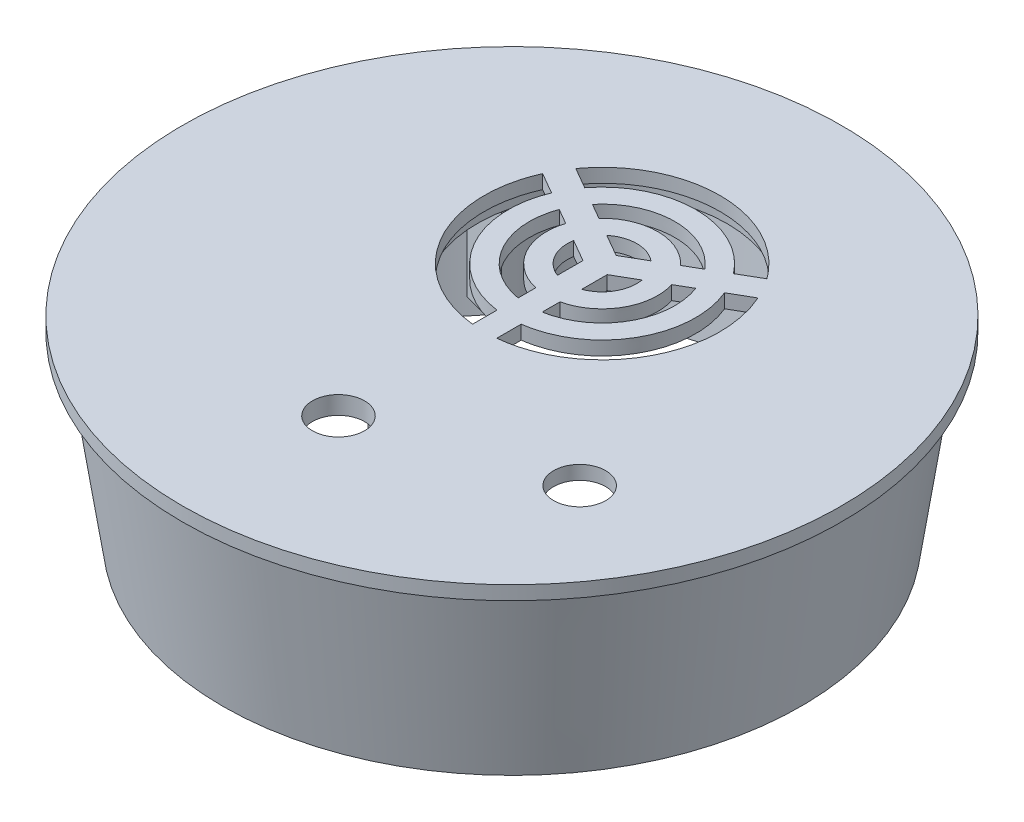
from build123d import *

# Parameters (mm, degrees)
INSIDECAPPLANE_SKETCH_R                        = 27.5
INSIDECAPPLANE_SKETCH_R_2                      = 18
SPEAKER_EXTRUDE_BOSS_DEPTH                     = 2
BOSS_EXTRUDE_SCREW_BOSSES_START                = 2.1
BOSS_EXTRUDE_SCREW_BOSSES_DEPTH                = 17
INSIDECAPPLANE2_SKETCH_R                       = 7.5
POT_SWITCH_MOUNT_THICKNESS_ADJ_DEPTH           = 0.6
HOLES_START                                    = -2
SKETCH5_R                                      = 3.75
HOLES_FOR_VOLUME_POT_AND_TESTING_PASSTHR_DEPTH = 74.995881596
VENT1_START                                    = -2
VENT1_DEPTH                                    = 2
F_4_0MM_DOWEL_HOLE1_D                          = 3.8
F_4_0MM_DOWEL_HOLE1_DEPTH                      = 18


# Read off the part's stored shape, not the designer's step: Vent1
with BuildPart() as part:
    # Sketch1 → Revolve1 (revolve)
    with BuildSketch(Plane.XY, mode=Mode.PRIVATE) as revolve1_sk:
        with BuildLine():
            Line((0, 0), (-47.5, 0))
            Line((-47.5, 0), (-47.5, -2))
            Line((-47.5, -2), (-45.5, -2))
            Line((-45.5, -2), (-41.702855897, -27.901871877))
            Line((-41.702855897, -27.901871877), (-39.681479372, -27.901871877))
            Line((-39.681479372, -27.901871877), (-43.310762695, -3.145046985))
            ThreePointArc((-43.310762695, -3.145046985), (-43.077990749, -2.346183124), (-42.321337927, -2))
            Line((-42.321337927, -2), (0, -2))
            Line((0, -2), (0, 0))
        make_face()
    revolve(revolve1_sk.sketch.rotate(Axis((0, 0, 0), (0, -1, 0)), 270), axis=Axis((0, 0, 0), (0, -1, 0)))

    # InsideCapPlane Sketch → Speaker Extrude Boss (add)
    with BuildSketch(Plane(origin=(0, -2, 0), x_dir=(-1, 0, 0), z_dir=(0, -1, 0))):
        with Locations(Location((0, 13, 0), (0, 0, 90))):
            Circle(INSIDECAPPLANE_SKETCH_R)
        with Locations(Location((0, 13, 0), (0, 0, 90))):
            Circle(INSIDECAPPLANE_SKETCH_R_2, mode=Mode.SUBTRACT)
    extrude(amount=SPEAKER_EXTRUDE_BOSS_DEPTH)

    # InsideCapPlane3 Sketch → Boss-Extrude-Screw-Bosses (add)
    with BuildSketch(Plane(origin=(0, -1.9, 0), x_dir=(-1, 0, 0), z_dir=(0, -1, 0)).offset(BOSS_EXTRUDE_SCREW_BOSSES_START)):
        with BuildLine():
            Line((-14.495998085, 27.495379937), (-19.445851089, 32.445021867))
            ThreePointArc((-19.445851089, 32.445021867), (-23.81584519, 26.749746103), (-26.562960223, 20.11752374))
            Line((-26.562960223, 20.11752374), (-19.801479439, 18.305790425))
            ThreePointArc((-19.801479439, 18.305790425), (-17.753630051, 23.249810731), (-14.495998085, 27.495379937))
        make_face()
        with BuildLine():
            Line((-5.305790425, -6.801479439), (-7.11752374, -13.562960223))
            ThreePointArc((-7.11752374, -13.562960223), (0.039898848, -14.499971056), (7.194572349, -13.542195251))
            Line((7.194572349, -13.542195251), (5.36322666, -6.786000096))
            ThreePointArc((5.36322666, -6.786000096), (0.029742777, -7.499978424), (-5.305790425, -6.801479439))
        make_face()
        with BuildLine():
            Line((26.562882451, 20.117813982), (19.801421464, 18.306006787))
            ThreePointArc((19.801421464, 18.306006787), (17.753342156, 23.250309376), (14.495342186, 27.496035834))
            Line((14.495342186, 27.496035834), (19.444971226, 32.445901728))
            ThreePointArc((19.444971226, 32.445901728), (23.815458989, 26.750415017), (26.562882451, 20.117813982))
        make_face()
    extrude(amount=BOSS_EXTRUDE_SCREW_BOSSES_DEPTH)

    # InsideCapPlane2 Sketch → Pot Switch Mount Thickness Adj (add)
    with BuildSketch(Plane(origin=(0, -2, 0), x_dir=(-1, 0, 0), z_dir=(0, -1, 0))):
        with Locations(Location((0, -25, 0), (0, 0, 90))):
            Circle(INSIDECAPPLANE2_SKETCH_R)
    extrude(amount=POT_SWITCH_MOUNT_THICKNESS_ADJ_DEPTH)

    # Sketch5 → Holes for Volume Pot and Testing Passthru (cut, through all)
    with BuildSketch(Plane(origin=(0, -2, 0), x_dir=(-1, 0, 0), z_dir=(0, -1, 0)).offset(HOLES_START)):
        with Locations(Location((0, -25, 0), (0, 0, 270))):
            Circle(SKETCH5_R)
        with Locations(Location((-26.094139168, -16.333437279, 0), (0, 0, 270))):
            Circle(SKETCH5_R)
    extrude(amount=HOLES_FOR_VOLUME_POT_AND_TESTING_PASSTHR_DEPTH, mode=Mode.SUBTRACT)

    # Vent1 outline → Vent1 (cut)
    with BuildSketch(Plane(origin=(0, 0, 0), x_dir=(1, 0, 0), z_dir=(0, 1, 0)).offset(VENT1_START)):
        with BuildLine():
            add(Edge.make_bspline(
                [(15.519300911, 19.939075404), (15.583522876, 19.79546379), (16.085852586, 18.628946061), (16.780829411, 16.337914505), (17.109585295, 13), (16.780829411, 9.662085495), (15.807195663, 6.452445173), (14.226100252, 3.494423711), (12.098303785, 0.901696215), (9.505576289, -1.226100252), (6.547554827, -2.807195663), (3.891911439, -3.612776278), (2.259180977, -3.857692346), (1.725444454, -3.91214322)],
                knots=[0.433081533, 0.433081533, 0.433081533, 0.433081533, 0.4375, 0.46875, 0.5, 0.53125, 0.5625, 0.59375, 0.625, 0.65625, 0.6875, 0.71875, 0.73381837, 0.73381837, 0.73381837, 0.73381837], degree=3))
            Line((15.519300911, 19.939075404), (12.467770616, 18.177325122))
            add(Edge.make_bspline(
                [(12.467770616, 18.177325122), (12.469306625, 18.173626212), (12.809331347, 17.353769398), (13.325952767, 15.650696813), (13.587023616, 13), (13.325952767, 10.349303187), (12.552773027, 7.800471167), (11.297197259, 5.451454123), (9.607476535, 3.392523465), (7.548545877, 1.702802741), (5.199528833, 0.447226973), (3.20691426, -0.157226049), (2.03318278, -0.349474516), (1.730576777, -0.38857496)],
                knots=[0.437358345, 0.437358345, 0.437358345, 0.437358345, 0.4375, 0.46875, 0.5, 0.53125, 0.5625, 0.59375, 0.625, 0.65625, 0.6875, 0.71875, 0.729541459, 0.729541459, 0.729541459, 0.729541459], degree=3))
            Line((1.730576777, -0.38857496), (1.725444454, -3.91214322))
        make_face()
        with BuildLine():
            Line((9.84112072, 16.660877866), (7.63541524, 15.387455007))
            add(Edge.make_bspline(
                [(7.63541524, 15.387455007), (7.720326587, 15.115883528), (7.920406374, 14.331722074), (8.05156955, 13), (7.896860899, 11.429216704), (7.438680312, 9.918797729), (6.694635413, 8.526787629), (5.693319428, 7.306680572), (4.473212371, 6.305364587), (3.134924148, 5.590034629), (2.190575013, 5.291869769), (1.738672338, 5.191227063)],
                knots=[0.451768034, 0.451768034, 0.451768034, 0.451768034, 0.46875, 0.5, 0.53125, 0.5625, 0.59375, 0.625, 0.65625, 0.6875, 0.715131904, 0.715131904, 0.715131904, 0.715131904], degree=3))
            Line((1.738672338, 5.191227063), (1.734977144, 2.644343614))
            add(Edge.make_bspline(
                [(9.84112072, 16.660877866), (10.036074735, 16.136708077), (10.377233842, 14.933683414), (10.567685035, 13), (10.36462993, 10.938346924), (9.76326791, 8.955922019), (8.786708979, 7.128908763), (7.47248175, 5.52751825), (5.871091237, 4.213291021), (4.044077981, 3.23673209), (2.620311471, 2.804837241), (1.839750578, 2.661891069), (1.734977144, 2.644343614)],
                knots=[0.443319192, 0.443319192, 0.443319192, 0.443319192, 0.46875, 0.5, 0.53125, 0.5625, 0.59375, 0.625, 0.65625, 0.6875, 0.71875, 0.723580727, 0.723580727, 0.723580727, 0.723580727], degree=3))
        make_face()
        with BuildLine():
            add(Edge.make_bspline(
                [(4.931252002, 13.826256872), (4.976959227, 13.553371604), (5.027251173, 12.949439282), (4.935538062, 12.01826044), (4.649175195, 11.07424858), (4.184147133, 10.204242268), (3.558324643, 9.441675357), (2.795757732, 8.815852867), (2.161728177, 8.476957009), (1.800342836, 8.334976158), (1.743202672, 8.313725073)],
                knots=[0.473578233, 0.473578233, 0.473578233, 0.473578233, 0.5, 0.53125, 0.5625, 0.59375, 0.625, 0.65625, 0.6875, 0.693321655, 0.693321655, 0.693321655, 0.693321655], degree=3))
            Line((4.931252002, 13.826256872), (1.748534686, 11.988774478))
            Line((1.748534686, 11.988774478), (1.743202672, 8.313725073))
        make_face()
        with BuildLine():
            add(Edge.make_bspline(
                [(-13.769021039, 22.970616385), (-13.24167323, 23.698769263), (-11.932400823, 25.234456827), (-9.505576289, 27.226100252), (-6.547554827, 28.807195663), (-3.337914505, 29.780829411), (0, 30.109585295), (3.337914505, 29.780829411), (6.547554827, 28.807195663), (9.505576289, 27.226100252), (11.932543011, 25.234340137), (13.241911504, 23.698489779), (13.769343149, 22.970171606)],
                knots=[0.099748857, 0.099748857, 0.099748857, 0.099748857, 0.125, 0.15625, 0.1875, 0.21875, 0.25, 0.28125, 0.3125, 0.34375, 0.375, 0.400256284, 0.400256284, 0.400256284, 0.400256284], degree=3))
            Line((-13.769021039, 22.970616385), (-10.717513064, 21.208763853))
            add(Edge.make_bspline(
                [(-10.717513064, 21.208763853), (-10.35689088, 21.679551825), (-9.381801949, 22.792682882), (-7.548545877, 24.297197259), (-5.199528833, 25.552773027), (-2.650696813, 26.325952767), (0, 26.587023616), (2.650696813, 26.325952767), (5.199528833, 25.552773027), (7.548545877, 24.297197259), (9.381914686, 22.792590361), (10.357082568, 21.679332997), (10.717777837, 21.208418183)],
                knots=[0.104025719, 0.104025719, 0.104025719, 0.104025719, 0.125, 0.15625, 0.1875, 0.21875, 0.25, 0.28125, 0.3125, 0.34375, 0.375, 0.395979414, 0.395979414, 0.395979414, 0.395979414], degree=3))
            Line((10.717777837, 21.208418183), (13.769343149, 22.970171606))
        make_face()
        with BuildLine():
            Line((-8.090925255, 19.692239492), (-5.88529867, 18.418767333))
            add(Edge.make_bspline(
                [(-5.88529867, 18.418767333), (-5.810799415, 18.499690587), (-5.372054669, 18.956974602), (-4.473212371, 19.694635413), (-3.081202271, 20.438680312), (-1.570783296, 20.896860899), (0, 21.05156955), (1.570783296, 20.896860899), (3.081202271, 20.438680312), (4.473212371, 19.694635413), (5.372121477, 18.956919774), (5.810918534, 18.499566433), (5.885473431, 18.418577495)],
                knots=[0.118435187, 0.118435187, 0.118435187, 0.118435187, 0.125, 0.15625, 0.1875, 0.21875, 0.25, 0.28125, 0.3125, 0.34375, 0.375, 0.381569946, 0.381569946, 0.381569946, 0.381569946], degree=3))
            Line((5.885473431, 18.418577495), (8.091141088, 19.691978538))
            add(Edge.make_bspline(
                [(-8.090925255, 19.692239492), (-7.880493124, 19.94665541), (-7.195138087, 20.700091811), (-5.871091237, 21.786708979), (-4.044077981, 22.76326791), (-2.061653076, 23.36462993), (0, 23.567685035), (2.061653076, 23.36462993), (4.044077981, 22.76326791), (5.871091237, 21.786708979), (7.195225767, 20.700019854), (7.880645205, 19.946488218), (8.091141088, 19.691978538)],
                knots=[0.109986495, 0.109986495, 0.109986495, 0.109986495, 0.125, 0.15625, 0.1875, 0.21875, 0.25, 0.28125, 0.3125, 0.34375, 0.375, 0.390018638, 0.390018638, 0.390018638, 0.390018638], degree=3))
        make_face()
        with BuildLine():
            add(Edge.make_bspline(
                [(-3.181157549, 16.85746568), (-3.051856125, 16.96409656), (-2.65427709, 17.259770111), (-1.92575142, 17.649175195), (-0.98173956, 17.935538062), (0, 18.032230969), (0.98173956, 17.935538062), (1.92575142, 17.649175195), (2.654324725, 17.25974465), (3.0519425, 16.964032323), (3.181281959, 16.85736308)],
                knots=[0.140245648, 0.140245648, 0.140245648, 0.140245648, 0.15625, 0.1875, 0.21875, 0.25, 0.28125, 0.3125, 0.34375, 0.359759485, 0.359759485, 0.359759485, 0.359759485], degree=3))
            Line((-3.181157549, 16.85746568), (3.2586e-05, 15.020728176))
            Line((3.2586e-05, 15.020728176), (3.181281959, 16.85736308))
        make_face()
        with BuildLine():
            add(Edge.make_bspline(
                [(-1.774512014, -3.907065606), (-2.291735122, -3.852784921), (-3.907722552, -3.607980029), (-6.547554827, -2.807195663), (-9.505576289, -1.226100252), (-12.098303785, 0.901696215), (-14.226100252, 3.494423711), (-15.807195663, 6.452445173), (-16.780829411, 9.662085495), (-17, 11.887361832), (-17, 13), (-17, 14.112638168), (-16.780829411, 16.337914505), (-16.085799086, 18.629122428), (-15.583377774, 19.795800741), (-15.519076274, 19.93957771)],
                knots=[0.766643455, 0.766643455, 0.766643455, 0.766643455, 0.78125, 0.8125, 0.84375, 0.875, 0.90625, 0.9375, 0.96875, 1, 1, 1, 1.03125, 1.0625, 1.066923618, 1.066923618, 1.066923618, 1.066923618], degree=3))
            Line((-1.774512014, -3.907065606), (-1.769419541, -0.383498751))
            add(Edge.make_bspline(
                [(-1.769419541, -0.383498751), (-2.058965695, -0.345232219), (-3.219470032, -0.153417297), (-5.199528833, 0.447226973), (-7.548545877, 1.702802741), (-9.607476535, 3.392523465), (-11.297197259, 5.451454123), (-12.552773027, 7.800471167), (-13.325952767, 10.349303187), (-13.5, 12.116434396), (-13.5, 13), (-13.5, 13.883565604), (-13.325952767, 15.650696813), (-12.809289011, 17.35390896), (-12.469195417, 18.173894346), (-12.467603621, 18.177727247)],
                knots=[0.770920362, 0.770920362, 0.770920362, 0.770920362, 0.78125, 0.8125, 0.84375, 0.875, 0.90625, 0.9375, 0.96875, 1, 1, 1, 1.03125, 1.0625, 1.062646788, 1.062646788, 1.062646788, 1.062646788], degree=3))
            Line((-12.467603621, 18.177727247), (-15.519076274, 19.93957771))
        make_face()
        with BuildLine():
            Line((-1.765019175, 2.649419908), (-1.761323976, 5.19630633))
            add(Edge.make_bspline(
                [(-1.761323976, 5.19630633), (-2.205384488, 5.296557418), (-3.1417815, 5.59369996), (-4.473212371, 6.305364587), (-5.693319428, 7.306680572), (-6.694635413, 8.526787629), (-7.438680312, 9.918797729), (-7.896860899, 11.429216704), (-8, 12.476405568), (-8, 13), (-8, 13.523594432), (-7.920397903, 14.331808083), (-7.720283997, 15.116050445), (-7.635338234, 15.38770128)],
                knots=[0.785329929, 0.785329929, 0.785329929, 0.785329929, 0.8125, 0.84375, 0.875, 0.90625, 0.9375, 0.96875, 1, 1, 1, 1.03125, 1.048237099, 1.048237099, 1.048237099, 1.048237099], degree=3))
            Line((-7.635338234, 15.38770128), (-9.841002656, 16.661195286))
            add(Edge.make_bspline(
                [(-1.765019175, 2.649419908), (-1.859729613, 2.665564909), (-2.630077121, 2.807799619), (-4.044077981, 3.23673209), (-5.871091237, 4.213291021), (-7.47248175, 5.52751825), (-8.786708979, 7.128908763), (-9.76326791, 8.955922019), (-10.36462993, 10.938346924), (-10.5, 12.312782308), (-10.5, 13), (-10.5, 13.687217692), (-10.377222723, 14.933796302), (-10.036012938, 16.136925984), (-9.841002656, 16.661195286)],
                knots=[0.776881096, 0.776881096, 0.776881096, 0.776881096, 0.78125, 0.8125, 0.84375, 0.875, 0.90625, 0.9375, 0.96875, 1, 1, 1, 1.03125, 1.056685941, 1.056685941, 1.056685941, 1.056685941], degree=3))
        make_face()
        with BuildLine():
            add(Edge.make_bspline(
                [(-1.756793645, 8.318802178), (-1.809343987, 8.338520086), (-2.166013865, 8.479247757), (-2.795757732, 8.815852867), (-3.558324643, 9.441675357), (-4.184147133, 10.204242268), (-4.649175195, 11.07424858), (-4.935538062, 12.01826044), (-5, 12.67275348), (-5, 13), (-5, 13.276739556), (-4.976950274, 13.553479113), (-4.93122536, 13.82641592)],
                knots=[0.807140162, 0.807140162, 0.807140162, 0.807140162, 0.8125, 0.84375, 0.875, 0.90625, 0.9375, 0.96875, 1, 1, 1, 1.0264269, 1.0264269, 1.0264269, 1.0264269], degree=3))
            Line((-1.756793645, 8.318802178), (-1.751466487, 11.990504789))
            Line((-1.751466487, 11.990504789), (-4.93122536, 13.82641592))
        make_face()
    extrude(amount=VENT1_DEPTH, mode=Mode.SUBTRACT)

    # Ø4.0mm Dowel Hole1
    with Locations(Plane(origin=(0, -21, 0), x_dir=(-1, 0, 0), z_dir=(0, -1, 0))):
        with Locations((0, -10.75), (-20.568272093, 24.874707707), (20.567889099, 24.875371068)):
            Hole(F_4_0MM_DOWEL_HOLE1_D / 2, depth=F_4_0MM_DOWEL_HOLE1_DEPTH)


solid = part.part
